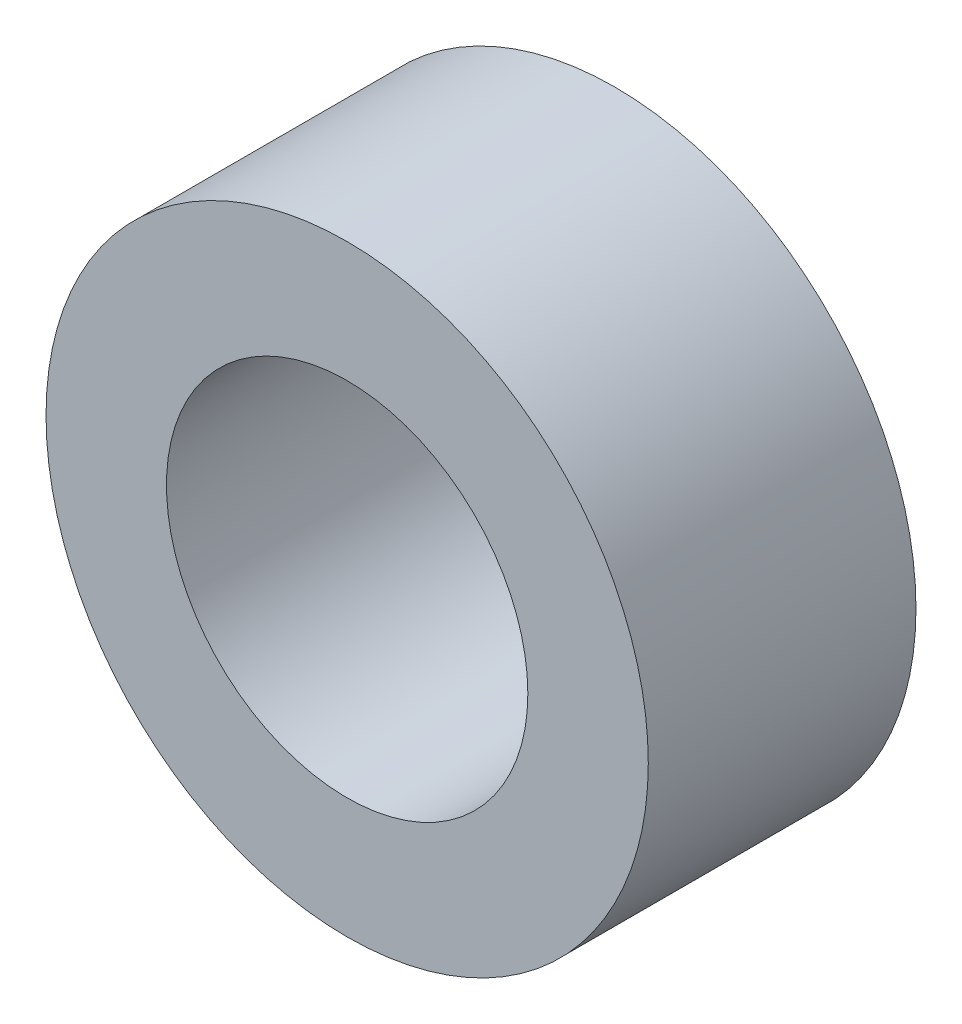
from build123d import *

# Parameters (mm, degrees)
SKETCH1_R      = 2.25
SKETCH1_R_2    = 1.35
EXTRUDE1_DEPTH = 1


with BuildPart() as part:
    # Sketch1 → Extrude1 (new, symmetric)
    with BuildSketch(Plane.XY):
        Circle(SKETCH1_R)
        Circle(SKETCH1_R_2, mode=Mode.SUBTRACT)
    extrude(amount=EXTRUDE1_DEPTH, both=True)


solid = part.part
